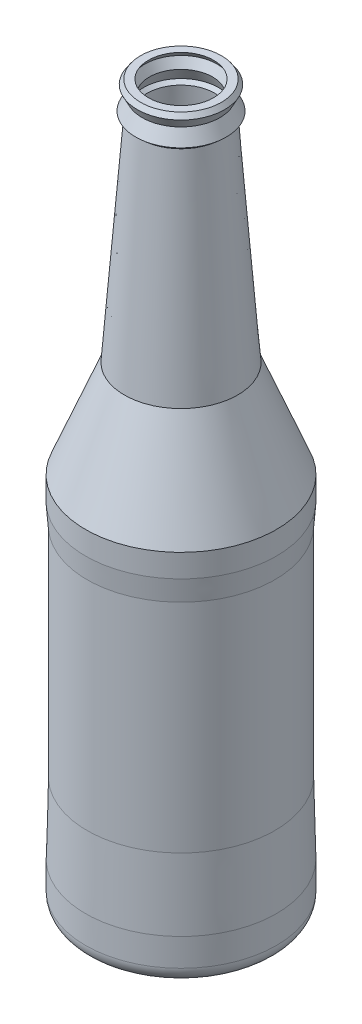
from build123d import *

# Parameters (mm, degrees)
FILLET2_R = 5


# Read off the part's stored shape, not the designer's step: Shell2
with BuildPart() as part:
    # Sketch1 → Revolve1 (revolve)
    with BuildSketch(Plane.XY, mode=Mode.PRIVATE) as revolve1_sk:
        Polygon((2.686675584, 14.691802026), (15.186675584, 14.691802026), (16.186675584, 13.242778256), (14.686675584, 10.327805917), (16.686675584, 6.141812908), (15.186675584, 4.836496853), (20.186675584, -61.163503147), (32.186675584, -91.163503147), (32.186675584, -98.267944917), (31.686675584, -104.864926562), (31.686675584, -171.996704513), (32.186675584, -193.979014243), (32.186675584, -205.127326289), (24.643709458, -210.308197974), (2.686675584, -210.308197974), align=None)
    revolve(revolve1_sk.sketch.rotate(Axis((2.686675584, -210.308197974, 0), (0, 1, 0)), 90), axis=Axis((2.686675584, -210.308197974, 0), (0, 1, 0)))

    # Fillet2
    fillet2_edges = [part.edges().sort_by_distance(p)[0] for p in [
        (2.686675584, -205.127326289, 29.5),
    ]]
    fillet(fillet2_edges, radius=FILLET2_R)

    # Shell2 outline → Shell2 (revolve, cut)
    with BuildSketch(Plane(origin=(2.686675584, 0, 0), x_dir=(1, 0, 0), z_dir=(0, 0, 1))):
        with BuildLine():
            Line((9.76769763, 10.360768085), (11.173521052, 13.092725677))
            Line((11.173521052, 13.092725677), (10.069966795, 14.691802026))
            Line((10.069966795, 14.691802026), (0, 14.691802026))
            Line((0, 14.691802026), (0, -208.308197974))
            Line((0, -208.308197974), (21.336339779, -208.308197974))
            Line((21.336339779, -208.308197974), (26.198491575, -204.968638423))
            ThreePointArc((26.198491575, -204.968638423), (27.154757496, -203.892994192), (27.5, -202.495760268))
            Line((27.5, -202.495760268), (27.5, -194.001756864))
            Line((27.5, -194.001756864), (27, -172.019447135))
            Line((27, -172.019447135), (27, -104.789242859))
            Line((27, -104.789242859), (27.5, -98.192261215))
            Line((27.5, -98.192261215), (27.5, -91.548667954))
            Line((27.5, -91.548667954), (15.528926693, -61.620984687))
            Line((15.528926693, -61.620984687), (10.429889715, 5.686303432))
            Line((10.429889715, 5.686303432), (11.539666623, 6.652043176))
            Line((11.539666623, 6.652043176), (9.76769763, 10.360768085))
        make_face()
    revolve(axis=Axis((2.686675584, 0, 0), (0, 1, 0)), mode=Mode.SUBTRACT)


solid = part.part
